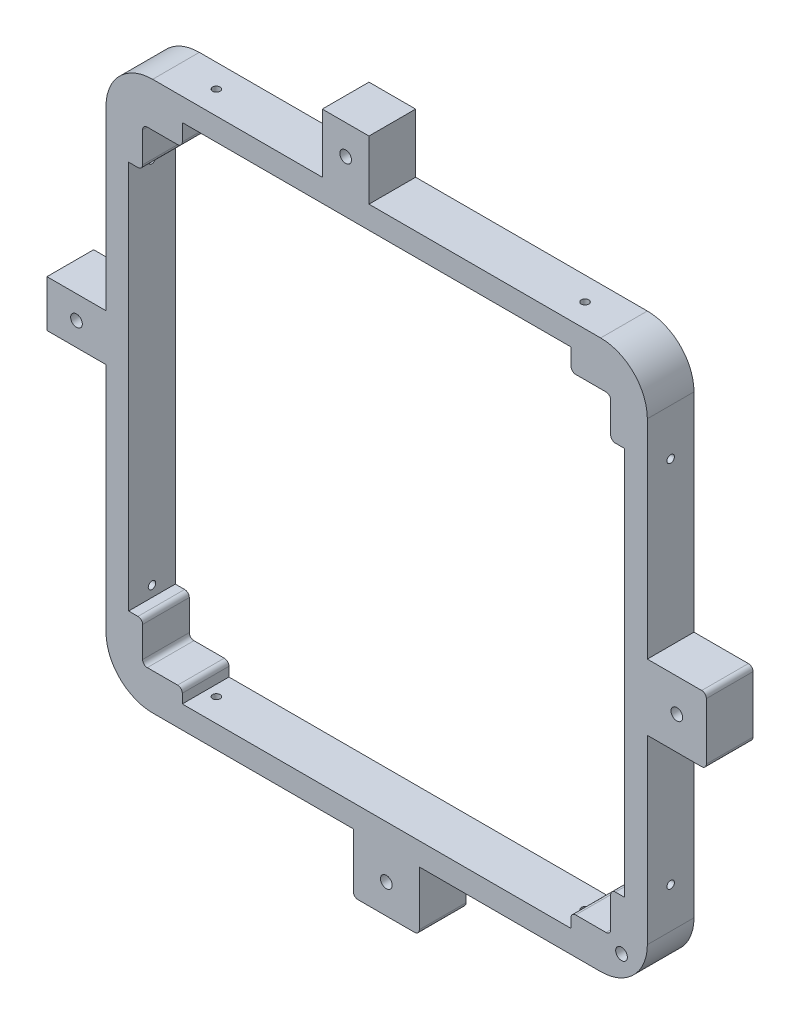
from build123d import *

# Parameters (mm, degrees)
SKETCH1_W                      = 116
SKETCH1_H                      = 117.6
BASE_DEPTH                     = 5
ARM_DEPTH                      = 5
CUT_EXTRUDE1_DEPTH             = 99.905226688
BOSS_EXTRUDE4_DEPTH            = 31
CLEARANCE_DEPTH                = 20
CUT_EXTRUDE2_DEPTH             = 94.167376264
CUT_EXTRUDE2_DEPTH_BACK        = 94.167376264
SKETCH42_W                     = 83.3
SKETCH42_H                     = 1.6
SKETCH12_W                     = 0.8
SKETCH12_H                     = 59.6
M2X0_4_TAPPED_HOLE1_AT_2_COUNT = 2
M2X0_4_TAPPED_HOLE1_AT_2_PITCH = 79
MIRROR1_COPY_1_SKETCH_W        = 0.8
MIRROR1_COPY_1_SKETCH_H        = 59.6
SKETCH15_W                     = 0.8
SKETCH15_H                     = 58
M2X0_4_TAPPED_HOLE2_AT_2_COUNT = 2
M2X0_4_TAPPED_HOLE2_AT_2_PITCH = 79
MIRROR2_COPY_1_SKETCH_W        = 0.8
MIRROR2_COPY_1_SKETCH_H        = 58
SKETCH16_W                     = 17.5
SKETCH16_H                     = 10
EXTENDER_DEPTH                 = 28.6716
ANGLED_HORIZONTAL_DEPTH        = 13.3284
ARM_START                      = -5
SKETCH21_W                     = 17.5
SKETCH21_H                     = 10
SKETCH21_W_2                   = 10
SKETCH21_H_2                   = 17.5
ARM_HOLDER_DEPTH               = 10
SKETCH44_W                     = 10
SKETCH44_H                     = 17.5
BOSS_EXTRUDE20_DEPTH           = 28.6716
BOSS_EXTRUDE21_DEPTH           = 13.3284
BOSS_EXTRUDE22_DEPTH           = 79.266670171
FILLET1_R                      = 1
FILLET2_R                      = 10
M3X0_5_TAPPED_HOLE2_D          = 2.5
M3X0_5_TAPPED_HOLE3_D          = 2.5
M3X0_5_TAPPED_HOLE3_DEPTH      = 29.81
M3X0_5_TAPPED_HOLE3_TIP        = 0.751075774
FILLET3_R                      = 1
BOSS_EXTRUDE23_REACH           = 300.947
SKETCH47_W                     = 11
SKETCH47_H                     = 10
BOSS_EXTRUDE24_DEPTH           = 31
SKETCH48_3_W                   = 14.142135624
SKETCH48_3_H                   = 12.65
BOSS_EXTRUDE25_DEPTH           = 42
SKETCH48_4_W                   = 14.142135624
SKETCH48_4_H                   = 12.65
BOSS_EXTRUDE26_DEPTH           = 10
FILLET6_R                      = 1
M3X0_5_TAPPED_HOLE5_D          = 2.5
M3X0_5_TAPPED_HOLE5_DEPTH      = 29.81
M3X0_5_TAPPED_HOLE5_TIP        = 0.751075774
SPLIT1_START                   = -47
SPLIT1_OUTLINE_R               = 1.25
SPLIT1_DEPTH                   = 42


# Read off the part's stored shape, not the designer's step: Split1
with BuildPart() as part:
    # Sketch1 → base (new, symmetric)
    with BuildSketch(Plane.XY):
        with Locations((0, 0.8)):
            Rectangle(SKETCH1_W, SKETCH1_H)
        Polygon((50.00188016, -50.00188016), (41.5, -50.00188016), (41.5, -53), (-41.5, -53), (-41.5, -50.00188016), (-50.00188016, -50.00188016), (-50.00188016, -41.5), (-53, -41.5), (-53, 41.5), (-50.00188016, 41.5), (-50.00188016, 50.00188016), (-41.5, 50.00188016), (-41.5, 53), (41.5, 53), (41.5, 50.00188016), (50.00188016, 50.00188016), (50.00188016, 41.5), (53, 41.5), (53, -41.5), (50.00188016, -41.5), align=None, mode=Mode.SUBTRACT)
    extrude(amount=BASE_DEPTH, both=True)

    # Sketch2 → arm (add, symmetric)
    with BuildSketch(Plane(origin=(0, 0, 0), x_dir=(0.7071067811865476, -0.7071067811865475, 0), z_dir=(0.7071067811865475, 0.7071067811865476, 0))):
        Polygon((70.925469101, 5), (82.024386618, 5), (82.024386618, 47), (8.024386618, 47), (19.024386618, 36), (70.925469101, 36), align=None)
    extrude(amount=ARM_DEPTH, both=True)

    # Sketch3 → Cut-Extrude1 (cut, through all)
    with BuildSketch(Plane.XY):
        Polygon((54.818019485, -61.889087297), (61.889087297, -54.818019485), (58, -50.928932188), (58, -58), (50.928932188, -58), align=None)
    extrude(amount=-CUT_EXTRUDE1_DEPTH, mode=Mode.SUBTRACT)

    # Sketch5 → Boss-Extrude4 (add)
    with BuildSketch(Plane(origin=(0, 0, -5), x_dir=(-1, 0, 0), z_dir=(0, 0, -1))):
        Polygon((-50.15188016, -50.15188016), (-46.616346254, -53.687414066), (-43.080812348, -50.15188016), align=None)
        Polygon((-53.687414066, -46.616346254), (-50.15188016, -50.15188016), (-50.15188016, -43.080812348), align=None)
    extrude(amount=BOSS_EXTRUDE4_DEPTH)

    # Sketch7 → clearance (cut)
    with BuildSketch(Plane.XY.offset(15)):
        Polygon((-41.65, 53.15), (41.65, 53.15), (41.65, 50.15188016), (50.15188016, 50.15188016), (50.15188016, 41.65), (53.15, 41.65), (53.15, -41.65), (50.15188016, -41.65), (50.15188016, -50.15188016), (41.65, -50.15188016), (41.65, -53.15), (-41.65, -53.15), (-41.65, -50.15188016), (-50.15188016, -50.15188016), (-50.15188016, -41.65), (-53.15, -41.65), (-53.15, 41.65), (-50.15188016, 41.65), (-50.15188016, 50.15188016), (-41.65, 50.15188016), align=None)
    extrude(amount=-CLEARANCE_DEPTH, mode=Mode.SUBTRACT)

    # Sketch42 → Cut-Extrude2 (cut, two sides: drawn at the far end of the back side and taken through both)
    with BuildSketch(Plane(origin=(0, 0, -5), x_dir=(-1, 0, 0), z_dir=(0, 0, -1)).offset(-CUT_EXTRUDE2_DEPTH_BACK)):
        with Locations((0, 53.95)):
            Rectangle(SKETCH42_W, SKETCH42_H)
    extrude(amount=CUT_EXTRUDE2_DEPTH + CUT_EXTRUDE2_DEPTH_BACK, mode=Mode.SUBTRACT)

    # Sketch12 → M2x0.4 Tapped Hole1 (revolve, cut)
    with BuildSketch(Plane(origin=(-39.35, 0, 0), x_dir=(0, 0, -1), z_dir=(1, 0, 0))):
        with Locations((0.4, 29.8)):
            Rectangle(SKETCH12_W, SKETCH12_H)
    m2x0_4_tapped_hole1 = revolve(axis=Axis((-39.35, -6.35, 0), (0, 1, 0)), mode=Mode.SUBTRACT)

    # M2x0.4 Tapped Hole1 at 2: M2x0.4 Tapped Hole1 ×2
    with Locations(*[(i * M2X0_4_TAPPED_HOLE1_AT_2_PITCH, 0, 0) for i in range(1, M2X0_4_TAPPED_HOLE1_AT_2_COUNT)]):
        add(m2x0_4_tapped_hole1, mode=Mode.SUBTRACT)

    # Mirror1: M2x0.4 Tapped Hole1 across plane
    add(m2x0_4_tapped_hole1.mirror(Plane.ZX), mode=Mode.SUBTRACT)

    # Mirror1 copy 1 sketch → Mirror1 copy 1 (revolve, cut)
    with BuildSketch(Plane(origin=(39.65, 0, 0), x_dir=(0, 0, -1), z_dir=(1, 0, 0))):
        with Locations((0.4, -29.8)):
            Rectangle(MIRROR1_COPY_1_SKETCH_W, MIRROR1_COPY_1_SKETCH_H)
    revolve(axis=Axis((39.65, 6.35, 0), (0, 1, 0)), mode=Mode.SUBTRACT)

    # Sketch15 → M2x0.4 Tapped Hole2 (revolve, cut)
    with BuildSketch(Plane.ZX.offset(39.65)):
        with Locations((0.4, 29)):
            Rectangle(SKETCH15_W, SKETCH15_H)
    m2x0_4_tapped_hole2 = revolve(axis=Axis((-6.35, 39.65, 0), (1, 0, 0)), mode=Mode.SUBTRACT)

    # M2x0.4 Tapped Hole2 at 2: M2x0.4 Tapped Hole2 ×2
    with Locations(*[(0, -i * M2X0_4_TAPPED_HOLE2_AT_2_PITCH, 0) for i in range(1, M2X0_4_TAPPED_HOLE2_AT_2_COUNT)]):
        add(m2x0_4_tapped_hole2, mode=Mode.SUBTRACT)

    # Mirror2: M2x0.4 Tapped Hole2 across plane
    add(m2x0_4_tapped_hole2.mirror(Plane(origin=(0, 0, 0), x_dir=(0, 0, 1), z_dir=(1, 0, 0))), mode=Mode.SUBTRACT)

    # Mirror2 copy 1 sketch → Mirror2 copy 1 (revolve, cut)
    with BuildSketch(Plane.ZX.offset(-39.35)):
        with Locations((0.4, -29)):
            Rectangle(MIRROR2_COPY_1_SKETCH_W, MIRROR2_COPY_1_SKETCH_H)
    revolve(axis=Axis((6.35, -39.35, 0), (1, 0, 0)), mode=Mode.SUBTRACT)

    # Sketch16 → extender (add)
    with BuildSketch(Plane(origin=(0, 0, -5), x_dir=(-1, 0, 0), z_dir=(0, 0, -1))):
        with Locations((61.9, 6.65)):
            Rectangle(SKETCH16_W, SKETCH16_H)
    extrude(amount=EXTENDER_DEPTH)

    # Sketch17 → angled horizontal (add)
    with BuildSketch(Plane(origin=(0, 0, -33.6716), x_dir=(-1, 0, 0), z_dir=(0, 0, -1))):
        Polygon((194.571356237, 153.071356237), (208.321356237, 139.321356237), (70.65, 1.65), (53.15, 1.65), (53.15, 11.65), align=None)
    extrude(amount=ANGLED_HORIZONTAL_DEPTH)

    # Sketch21 → Arm Holder (add)
    with BuildSketch(Plane.XY.offset(ARM_START)):
        with Locations((-61.9, 6.65)):
            Rectangle(SKETCH21_W, SKETCH21_H)
        with Locations((-6.65, 63.5)):
            Rectangle(SKETCH21_W_2, SKETCH21_H_2)
    extrude(amount=ARM_HOLDER_DEPTH)

    # Sketch44 → Boss-Extrude20 (add)
    with BuildSketch(Plane(origin=(0, 0, -5), x_dir=(-1, 0, 0), z_dir=(0, 0, -1))):
        with Locations((6.65, 63.5)):
            Rectangle(SKETCH44_W, SKETCH44_H)
    extrude(amount=BOSS_EXTRUDE20_DEPTH)

    # Sketch45 → Boss-Extrude21 (add)
    with BuildSketch(Plane(origin=(0, 0, -33.6716), x_dir=(-1, 0, 0), z_dir=(0, 0, -1))):
        Polygon((1.65, 72.25), (1.65, 54.75), (11.65, 54.75), (152.271356237, 195.371356237), (138.521356237, 209.121356237), align=None)
    extrude(amount=BOSS_EXTRUDE21_DEPTH)

    # Sketch46 → Boss-Extrude22 (add)
    with BuildSketch(Plane(origin=(-34.5, -34.5, 0), x_dir=(0, 0, 1), z_dir=(-0.7071067811865476, -0.7071067811865476, 0))):
        Polygon((-47, 232.492119421), (-47, 245.820519421), (-33.6716, 245.820519421), align=None)
    extrude(amount=-BOSS_EXTRUDE22_DEPTH)

    # Fillet1
    fillet1_edges = [part.edges().sort_by_distance(p)[0] for p in [
        (50.15188016, -50.15188016, -15.5),
        (-41.65, 50.15188016, 0),
        (41.65, 50.15188016, 0),
        (50.15188016, 50.15188016, 0),
        (50.15188016, 41.65, 0),
        (50.15188016, -41.65, 0),
        (41.65, -50.15188016, 0),
        (-41.65, -50.15188016, 0),
        (-50.15188016, -50.15188016, 0),
        (-50.15188016, -41.65, 0),
        (-50.15188016, 41.65, 0),
        (-50.15188016, 50.15188016, 0),
    ]]
    fillet(fillet1_edges, radius=FILLET1_R)

    # Fillet2
    # the kernel refuses this fillet: 10 mm, written as the material it takes off along each edge
    with BuildSketch(Plane(origin=(58, -58, -72), x_dir=(-1, 0, 0), z_dir=(0, 0, 1))) as fillet2_piece_1:
        with BuildLine():
            CenterArc((FILLET2_R, -FILLET2_R), FILLET2_R, 90, 90)
            Line((0, -FILLET2_R), (0, 0))
            Line((0, 0), (FILLET2_R, 0))
        make_face()
    extrude(amount=102, mode=Mode.SUBTRACT)
    with BuildSketch(Plane(origin=(-58, -58, 30), x_dir=(0, 1, 0), z_dir=(0, 0, -1)), Plane(origin=(-58, 59.6, 30), x_dir=(1, 0, 0), z_dir=(0, 0, -1))) as fillet2_piece_2:
        with BuildLine():
            CenterArc((FILLET2_R, FILLET2_R), FILLET2_R, 180, 90)
            Line((0, FILLET2_R), (0, 0))
            Line((0, 0), (FILLET2_R, 0))
        make_face()
    extrude(amount=60, mode=Mode.SUBTRACT)
    with BuildSketch(Plane(origin=(58, 59.6, -30), x_dir=(0, -1, 0), z_dir=(0, 0, 1))) as fillet2_piece_3:
        with BuildLine():
            CenterArc((FILLET2_R, -FILLET2_R), FILLET2_R, 90, 90)
            Line((0, -FILLET2_R), (0, 0))
            Line((0, 0), (FILLET2_R, 0))
        make_face()
    extrude(amount=60, mode=Mode.SUBTRACT)

    # M3x0.5 Tapped Hole2 (through all)
    with Locations(Plane(origin=(0, 0, -47), x_dir=(-1, 0, 0), z_dir=(0, 0, -1))):
        with Locations((-52.465379323, -52.465379323)):
            Hole(M3X0_5_TAPPED_HOLE2_D / 2)

    # M3x0.5 Tapped Hole3
    with Locations(Plane.XY.offset(5)):
        with Locations((-64.325, 6.65), (-6.65, 65.925)):
            Hole(M3X0_5_TAPPED_HOLE3_D / 2, depth=M3X0_5_TAPPED_HOLE3_DEPTH)
            with Locations((0, 0, -(M3X0_5_TAPPED_HOLE3_DEPTH + M3X0_5_TAPPED_HOLE3_TIP / 2))):  # 118° drill point
                Cone(0, M3X0_5_TAPPED_HOLE3_D / 2, M3X0_5_TAPPED_HOLE3_TIP, mode=Mode.SUBTRACT)

    # Fillet3
    fillet3_edges = [part.edges().sort_by_distance(p)[0] for p in [
        (-53.15, 1.65, -26),
        (-1.65, 54.75, -26),
    ]]
    fillet(fillet3_edges, radius=FILLET3_R)

    # Boss-Extrude23: up to this plane
    boss_extrude23_end = Plane(origin=(0, -58, 5), z_dir=(0, -1, 0))
    # Sketch47 → Boss-Extrude23 (add, up to the surface)
    with BuildSketch(Plane(origin=(-3.535533906, -3.535533906, 0), x_dir=(0, 0, 1), z_dir=(-0.7071067811865472, -0.7071067811865478, 0)), mode=Mode.PRIVATE) as boss_extrude23_sk1:
        with Locations((-41.5, -42.474927859)):
            Rectangle(SKETCH47_W, SKETCH47_H)
    boss_extrude23_tool1 = split(extrude(boss_extrude23_sk1.sketch, amount=BOSS_EXTRUDE23_REACH, mode=Mode.PRIVATE), bisect_by=boss_extrude23_end, keep=Keep.BOTH, mode=Mode.PRIVATE)
    boss_extrude23 = boss_extrude23_tool1.solids().sort_by_distance((26.498776, -33.569843, -41.5))[0]
    add(boss_extrude23)

    # Sketch48 → Boss-Extrude24 (add)
    with BuildSketch(Plane(origin=(0, 0, -5), x_dir=(-1, 0, 0), z_dir=(0, 0, -1))):
        Polygon((-13.989686851, -53.15), (-9.139686851, -58), (5.002448773, -58), (0.152448773, -53.15), align=None)
    boss_extrude24 = extrude(amount=BOSS_EXTRUDE24_DEPTH)

    # Sketch48<3> → Boss-Extrude25 (add)
    with BuildSketch(Plane(origin=(0, 0, -5), x_dir=(-1, 0, 0), z_dir=(0, 0, -1))):
        with Locations((-2.068619039, -64.325)):
            Rectangle(SKETCH48_3_W, SKETCH48_3_H)
    boss_extrude25 = extrude(amount=BOSS_EXTRUDE25_DEPTH)

    # Sketch48<4> → Boss-Extrude26 (add)
    with BuildSketch(Plane(origin=(0, 0, -5), x_dir=(-1, 0, 0), z_dir=(0, 0, -1))):
        with Locations((-2.068619039, -64.325)):
            Rectangle(SKETCH48_4_W, SKETCH48_4_H)
    boss_extrude26 = extrude(amount=-BOSS_EXTRUDE26_DEPTH)

    # Sketch50 → M3x0.5 Tapped Hole4 (revolve, cut)
    with BuildSketch(Plane(origin=(2.068619039, -64.325, 5), x_dir=(0, -1, 0), z_dir=(1, 0, 0))):
        Polygon((0, 0), (0, 30.561075774), (1.25, 29.81), (1.25, 0), align=None)
    m3x0_5_tapped_hole4 = revolve(axis=Axis((2.068619039, -64.325, 11.35), (0, 0, -1)), mode=Mode.SUBTRACT)

    # Mirror3: Boss-Extrude23, Boss-Extrude24, Boss-Extrude25, Boss-Extrude26, M3x0.5 Tapped Hole4 across plane
    add(boss_extrude23.mirror(Plane(origin=(0, 0, 0), x_dir=(0, 0, 1), z_dir=(0.7071067811865475, 0.7071067811865476, 0))))
    add(boss_extrude24.mirror(Plane(origin=(0, 0, 0), x_dir=(0, 0, 1), z_dir=(0.7071067811865475, 0.7071067811865476, 0))))
    add(boss_extrude25.mirror(Plane(origin=(0, 0, 0), x_dir=(0, 0, 1), z_dir=(0.7071067811865475, 0.7071067811865476, 0))))
    add(boss_extrude26.mirror(Plane(origin=(0, 0, 0), x_dir=(0, 0, 1), z_dir=(0.7071067811865475, 0.7071067811865476, 0))))
    add(m3x0_5_tapped_hole4.mirror(Plane(origin=(0, 0, 0), x_dir=(0, 0, 1), z_dir=(0.7071067811865475, 0.7071067811865476, 0))), mode=Mode.SUBTRACT)

    # Fillet6
    fillet6_edges = [part.edges().sort_by_distance(p)[0] for p in [
        (2.068619039, -70.65, -47),
        (9.139686851, -70.65, -21),
        (-5.002448773, -70.65, -21),
        (70.65, -9.139686851, -21),
        (70.65, 5.002448773, -21),
        (70.65, -2.068619039, -47),
    ]]
    fillet(fillet6_edges, radius=FILLET6_R)

    # M3x0.5 Tapped Hole5
    with Locations(Plane(origin=(0, 0, -47), x_dir=(-1, 0, 0), z_dir=(0, 0, -1))):
        with Locations((-2.068619039, -63.825), (-63.825, -2.068619039), (62.4, 7.15), (7.15, 64)):
            Hole(M3X0_5_TAPPED_HOLE5_D / 2, depth=M3X0_5_TAPPED_HOLE5_DEPTH)
            with Locations((0, 0, -(M3X0_5_TAPPED_HOLE5_DEPTH + M3X0_5_TAPPED_HOLE5_TIP / 2))):  # 118° drill point
                Cone(0, M3X0_5_TAPPED_HOLE5_D / 2, M3X0_5_TAPPED_HOLE5_TIP, mode=Mode.SUBTRACT)

    # Split1 outline → Split1 (cut)
    # profile 1 of 2: a face of its own
    with BuildSketch(Plane.XY.offset(SPLIT1_START)):
        with BuildLine():
            Line((30.03430952, -22.963241708), (-47.678932174, 54.749999986))
            Line((-47.678932174, 54.749999986), (-53.149999983, 54.75))
            Line((-53.149999983, 54.75), (-53.15, 46.078932174))
            Line((-53.15, 46.078932174), (22.963241708, -30.03430952))
            Line((22.963241708, -30.03430952), (-5.002448773, -58))
            Line((-5.002448773, -58), (-5.002448773, -69.65))
            ThreePointArc((-5.002448773, -69.65), (-4.709555554, -70.357106781), (-4.002448773, -70.65))
            Line((-4.002448773, -70.65), (8.139686851, -70.65))
            ThreePointArc((8.139686851, -70.65), (8.846793632, -70.357106781), (9.139686851, -69.65))
            Line((9.139686851, -69.65), (9.139686851, -58))
            Line((9.139686851, -58), (30.03430952, -37.105377332))
            Line((30.03430952, -37.105377332), (50.588190451, -57.659258263))
            ThreePointArc((50.588190451, -57.659258263), (55.071067812, -55.071067812), (57.659258263, -50.588190451))
            Line((57.659258263, -50.588190451), (37.105377332, -30.03430952))
            Line((37.105377332, -30.03430952), (58, -9.139686851))
            Line((58, -9.139686851), (69.65, -9.139686851))
            ThreePointArc((69.65, -9.139686851), (70.357106781, -8.846793632), (70.65, -8.139686851))
            Line((70.65, -8.139686851), (70.65, 4.002448773))
            ThreePointArc((70.65, 4.002448773), (70.357106781, 4.709555554), (69.65, 5.002448773))
            Line((69.65, 5.002448773), (58, 5.002448773))
            Line((58, 5.002448773), (30.03430952, -22.963241708))
        make_face()
        with Locations((52.465379323, -52.465379323)):
            Circle(SPLIT1_OUTLINE_R, mode=Mode.SUBTRACT)
        with BuildLine():
            ThreePointArc((64.075, -0.843874168), (65.075, -2.068619039), (64.075, -3.29336391))
            ThreePointArc((64.075, -3.29336391), (63.075, -2.068619039), (64.075, -0.843874168))
        make_face(mode=Mode.SUBTRACT)
        with BuildLine():
            ThreePointArc((3.29336391, -64.075), (2.068619039, -65.075), (0.843874168, -64.075))
            ThreePointArc((0.843874168, -64.075), (2.068619039, -63.075), (3.29336391, -64.075))
        make_face(mode=Mode.SUBTRACT)
    # profile 2 of 2: a face of its own
    with BuildSketch(Plane.XY.offset(SPLIT1_START)):
        with BuildLine():
            Line((-53.149999983, 54.749999984), (-53.14999997, 96.24999997))
            Line((-53.14999997, 96.24999997), (-11.65, 54.75))
            Line((-11.65, 54.75), (-2.65, 54.75))
            ThreePointArc((-2.65, 54.75), (-1.942893219, 55.042893219), (-1.65, 55.75))
            Line((-1.65, 55.75), (-1.65, 72.25))
            Line((-1.65, 72.25), (-138.521356237, 209.121356237))
            Line((-138.521356237, 209.121356237), (-208.321356237, 139.321356237))
            Line((-208.321356237, 139.321356237), (-70.65, 1.65))
            Line((-70.65, 1.65), (-54.15, 1.65))
            ThreePointArc((-54.15, 1.65), (-53.442893219, 1.942893219), (-53.15, 2.65))
            Line((-53.15, 2.65), (-53.15, 11.65))
            Line((-53.15, 11.65), (-96.24999997, 54.74999997))
            Line((-96.24999997, 54.74999997), (-53.149999983, 54.749999984))
        make_face()
        with BuildLine():
            ThreePointArc((-63.552898996, 7.633036133), (-63.115145371, 6.964247955), (-63.172101004, 6.166963867))
            ThreePointArc((-63.172101004, 6.166963867), (-63.609854629, 6.835752045), (-63.552898996, 7.633036133))
        make_face(mode=Mode.SUBTRACT)
        with BuildLine():
            ThreePointArc((-6.166963867, 64.772101004), (-6.964247955, 64.715145371), (-7.633036133, 65.152898996))
            ThreePointArc((-7.633036133, 65.152898996), (-6.835752045, 65.209854629), (-6.166963867, 64.772101004))
        make_face(mode=Mode.SUBTRACT)
    extrude(amount=SPLIT1_DEPTH, mode=Mode.SUBTRACT)


solid = part.part
